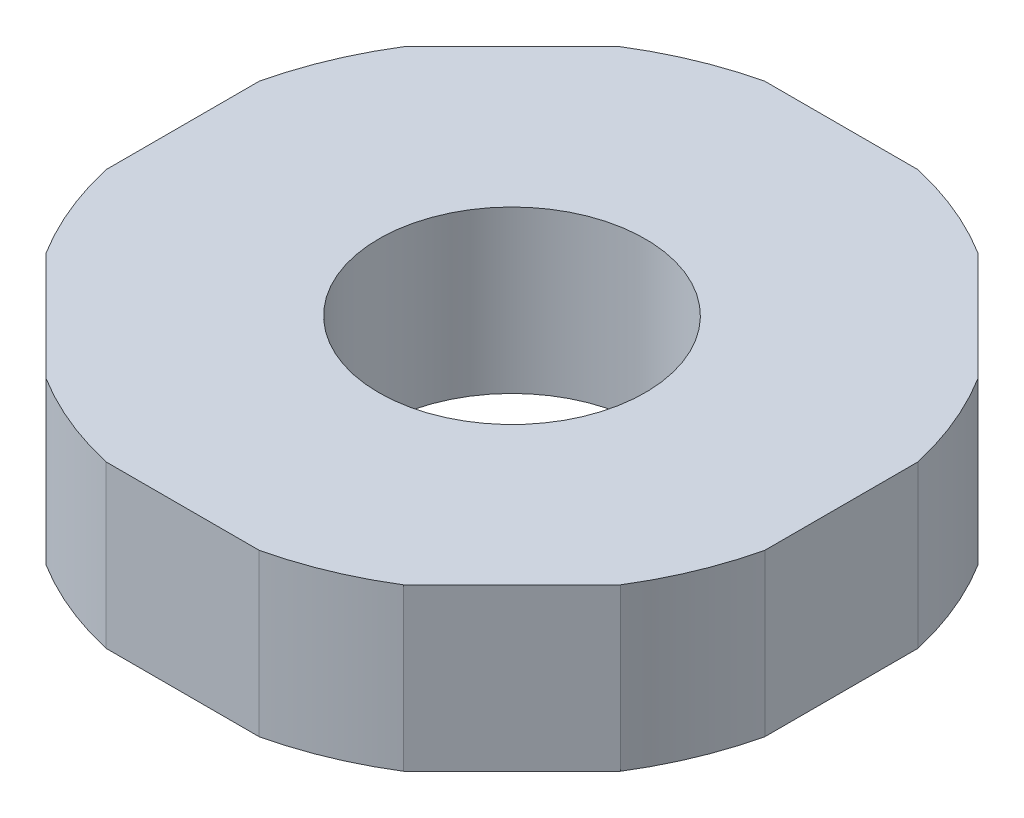
from build123d import *

# Parameters (mm, degrees)
SKETCH1_R           = 2.475
BOSS_EXTRUDE1_DEPTH = 3


with BuildPart() as part:
    # Sketch1 → Boss-Extrude1 (new body)
    with BuildSketch(Plane(origin=(0, 0, 0), x_dir=(1, 0, 0), z_dir=(0, 1, 0))):
        with BuildLine():
            Line((3.320799962, -5.336054288), (5.336054288, -3.320799962))
            ThreePointArc((5.336054288, -3.320799962), (5.806580124, -2.405164238), (6.121320344, -1.425))
            Line((6.121320344, -1.425), (6.121320344, 1.425))
            ThreePointArc((6.121320344, 1.425), (5.806580124, 2.405164238), (5.336054288, 3.320799962))
            Line((5.336054288, 3.320799962), (3.320799962, 5.336054288))
            ThreePointArc((3.320799962, 5.336054288), (2.405164238, 5.806580124), (1.425, 6.121320344))
            Line((1.425, 6.121320344), (-1.425, 6.121320344))
            ThreePointArc((-1.425, 6.121320344), (-2.405164238, 5.806580124), (-3.320799962, 5.336054288))
            Line((-3.320799962, 5.336054288), (-5.336054288, 3.320799962))
            ThreePointArc((-5.336054288, 3.320799962), (-5.806580124, 2.405164238), (-6.121320344, 1.425))
            Line((-6.121320344, 1.425), (-6.121320344, -1.425))
            ThreePointArc((-6.121320344, -1.425), (-5.806580124, -2.405164238), (-5.336054288, -3.320799962))
            Line((-5.336054288, -3.320799962), (-3.320799962, -5.336054288))
            ThreePointArc((-3.320799962, -5.336054288), (-2.405164238, -5.806580124), (-1.425, -6.121320344))
            Line((-1.425, -6.121320344), (1.425, -6.121320344))
            ThreePointArc((1.425, -6.121320344), (2.405164238, -5.806580124), (3.320799962, -5.336054288))
        make_face()
        Circle(SKETCH1_R, mode=Mode.SUBTRACT)
    extrude(amount=-BOSS_EXTRUDE1_DEPTH)


solid = part.part
